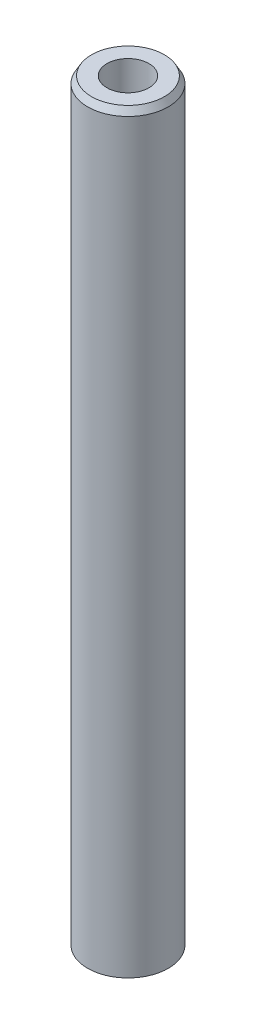
from build123d import *
from OCP.BRepFilletAPI import BRepFilletAPI_MakeChamfer

# Parameters (mm, degrees)
SKETCH1_R           = 5
BOSS_EXTRUDE1_DEPTH = 93.848988151
SKETCH2_R           = 2.606596591
CUT_EXTRUDE1_DEPTH  = 95.114996557
CHAMFER1_SIZE       = 0.847106689
CHAMFER1_SIZE2      = 0.489077275


with BuildPart() as part:
    # Sketch1 → Boss-Extrude1 (new body)
    with BuildSketch(Plane(origin=(0, 0, 0), x_dir=(1, 0, 0), z_dir=(0, 1, 0))):
        Circle(SKETCH1_R)
    extrude(amount=BOSS_EXTRUDE1_DEPTH)

    # Sketch2 → Cut-Extrude1 (cut, through all)
    with BuildSketch(Plane(origin=(0, 0, 0), x_dir=(1, 0, 0), z_dir=(0, 1, 0))):
        Circle(SKETCH2_R)
    extrude(amount=CUT_EXTRUDE1_DEPTH, mode=Mode.SUBTRACT)

    # Chamfer1: one chamfer whose edges measure the first distance from different faces: ONE call of the kernel's chamfer builder (chamfer() names one face for all edges)
    chamfer1_edges_1 = [part.edges().sort_by_distance(p)[0] for p in [
        (-5, 93.848988151, 0),
    ]]
    chamfer1_side_1 = [part.faces().sort_by_distance(p)[0] for p in [
        (-5, 46.924494075, 0),
    ]]
    chamfer1_edges_2 = [part.edges().sort_by_distance(p)[0] for p in [
        (-5, 0, 0),
    ]]
    chamfer1_side_2 = [part.faces().sort_by_distance(p)[0] for p in [
        (-4.858578644, 0, 0),
    ]]
    chamfer1 = BRepFilletAPI_MakeChamfer(part.part.solid().wrapped)
    for e in chamfer1_edges_1:
        chamfer1.Add(CHAMFER1_SIZE, CHAMFER1_SIZE2, e.wrapped, chamfer1_side_1[0].wrapped)  # the first distance lies on this face
    for e in chamfer1_edges_2:
        chamfer1.Add(CHAMFER1_SIZE, CHAMFER1_SIZE2, e.wrapped, chamfer1_side_2[0].wrapped)  # the first distance lies on this face
    add(Compound.cast(chamfer1.Shape()), mode=Mode.REPLACE)


solid = part.part
